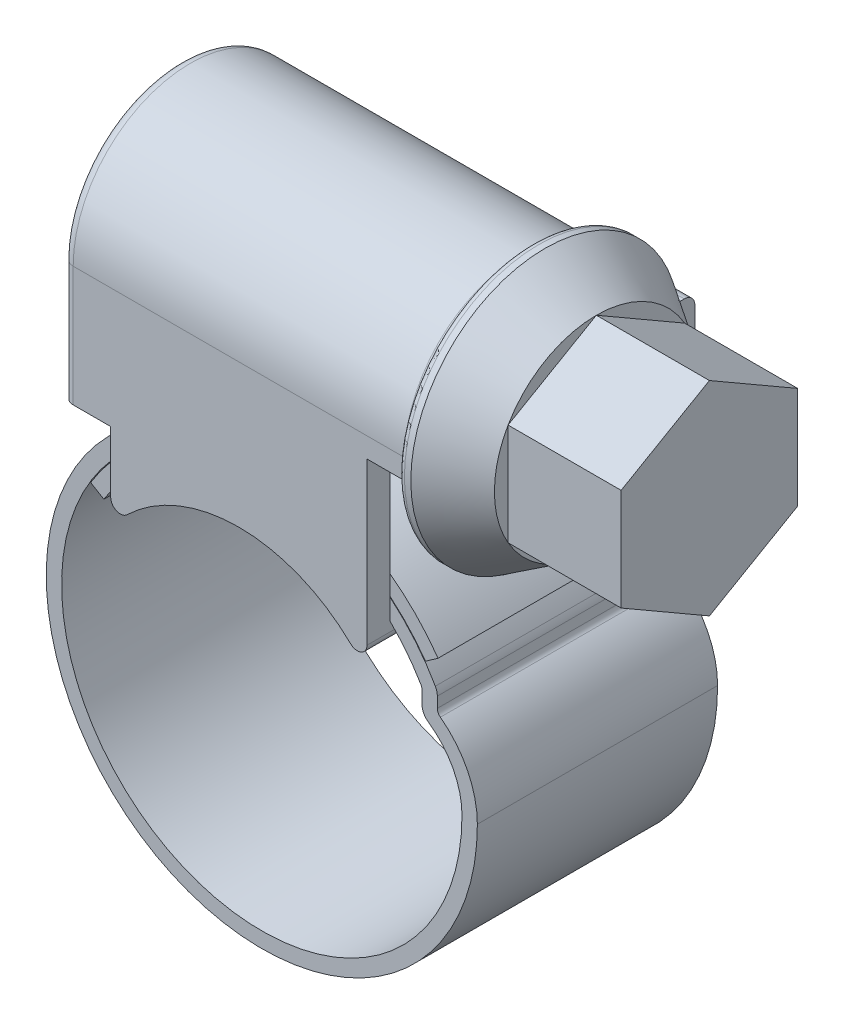
from build123d import *

# Parameters (mm, degrees)
EXTRUDE_THIN1_DEPTH      = 4.7625
BOSS_EXTRUDE1_DEPTH      = 6.98845
BOSS_EXTRUDE1_DEPTH_BACK = 6.98845
SHELL2_START             = -6.07845
SHELL2_DEPTH             = 12.1569
BOSS_EXTRUDE2_DEPTH      = 5.6725
BOSS_EXTRUDE2_DEPTH_BACK = 6.3921
BOSS_EXTRUDE9_START      = -0.91
BOSS_EXTRUDE9_DEPTH      = 0.91
BOSS_EXTRUDE10_START     = 0.91
BOSS_EXTRUDE10_DEPTH     = 0.91
CUT_EXTRUDE3_DEPTH       = 21.144492034
CUT_EXTRUDE3_DEPTH_BACK  = 21.144492034
FILLET3_R                = 0.419307
FILLET8_R                = 0.838614
CHAMFER2_SIZE            = 0.762
SKETCH31_W               = 0.91
SKETCH31_H               = 2.38125
BOSS_EXTRUDE7_DEPTH      = 7.0231
FILLET6_R                = 0.254
CUT_EXTRUDE4_DEPTH       = 24.499299408
CUT_EXTRUDE4_DEPTH_BACK  = 24.499299408
SKETCH35_W               = 1.90845
SKETCH35_H               = 3.96875
FILLET7_R                = 0.381
FILLET9_R                = 0.3048
FILLET10_R               = 0.6096


# Read off the part's stored shape, not the designer's step: Shell2
with BuildPart() as part:
    # Sketch2 → Extrude-Thin1 (new, symmetric)
    with BuildSketch(Plane.XY):
        with BuildLine():
            ThreePointArc((-6.262940862, 3.755273359), (0.086356754, 7.30198937), (6.35, 3.6061068))
            Line((6.35, 3.6061068), (6.35, 2.6917068))
            ThreePointArc((6.35, 2.6917068), (7.511063175, 1.56248534), (7.9375, 0))
            ThreePointArc((7.9375, 0), (-7.566981364, -2.396810231), (6.490016716, 4.569856592))
            Line((6.490016716, 4.569856592), (6.98845, 4.920821579))
            ThreePointArc((6.98845, 4.920821579), (-8.148125533, -2.580885257), (8.5471, 0))
            ThreePointArc((8.5471, 0), (8.126188249, 1.710330505), (6.9596, 3.029977804))
            Line((6.9596, 3.029977804), (6.9596, 3.763680944))
            ThreePointArc((6.9596, 3.763680944), (0.175564575, 7.910151926), (-6.785760274, 4.068757049))
            Line((-6.785760274, 4.068757049), (-6.262940862, 3.755273359))
        make_face()
    extrude(amount=EXTRUDE_THIN1_DEPTH, both=True)

    # Fillet9
    fillet9_edges = [part.edges().sort_by_distance(p)[0] for p in [
        (6.35, 3.6061068, 0),
        (6.9596, 3.029977804, 0),
    ]]
    fillet(fillet9_edges, radius=FILLET9_R)

    # Fillet10
    fillet10_edges = [part.edges().sort_by_distance(p)[0] for p in [
        (6.35, 2.6917068, 0),
        (6.9596, 3.763680944, 0),
    ]]
    fillet(fillet10_edges, radius=FILLET10_R)


with BuildPart() as body_2:
    # Sketch3 → Boss-Extrude1 (new, two sides: drawn at the far end of the back side and taken through both)
    with BuildSketch(Plane(origin=(0, 0, 0), x_dir=(0, 0, -1), z_dir=(1, 0, 0)).offset(-BOSS_EXTRUDE1_DEPTH_BACK)):
        with BuildLine():
            Line((-5.6725, 8.5471), (-5.6725, 7.29585))
            Line((-5.6725, 7.29585), (-4.7625, 7.29585))
            Line((-4.7625, 7.29585), (-4.7625, 8.5471))
            Line((-4.7625, 8.5471), (6.4175, 8.5471))
            Line((6.4175, 8.5471), (6.4175, 7.29585))
            Line((6.4175, 7.29585), (7.3275, 7.29585))
            Line((7.3275, 7.29585), (7.3275, 8.5471))
            Line((7.3275, 8.5471), (7.3275, 10.47085))
            Line((7.3275, 10.47085), (3.619930574, 10.47085))
            Line((3.619930574, 10.47085), (3.619930574, 12.058735616))
            ThreePointArc((3.619930574, 12.058735616), (-1.026284713, 16.704950903), (-5.6725, 12.058735616))
            Line((-5.6725, 12.058735616), (-5.6725, 10.47085))
            Line((-5.6725, 10.47085), (-5.6725, 8.5471))
        make_face()
    extrude(amount=BOSS_EXTRUDE1_DEPTH + BOSS_EXTRUDE1_DEPTH_BACK)

    # Shell2 outline → Shell2 (cut)
    with BuildSketch(Plane.YZ.offset(SHELL2_START)):
        with BuildLine():
            Line((8.5471, -6.4175), (9.56085, -6.4175))
            Line((9.56085, -6.4175), (9.56085, -2.709930574))
            Line((9.56085, -2.709930574), (12.058735616, -2.709930574))
            ThreePointArc((12.058735616, -2.709930574), (15.794950903, 1.026284713), (12.058735616, 4.7625))
            Line((12.058735616, 4.7625), (8.5471, 4.7625))
            Line((8.5471, 4.7625), (8.5471, -6.4175))
        make_face()
    extrude(amount=SHELL2_DEPTH, mode=Mode.SUBTRACT)


with BuildPart() as body_3:
    # Sketch4 → Boss-Extrude2 (new, two sides: drawn at the far end of the back side and taken through both)
    with BuildSketch(Plane.XY.offset(-BOSS_EXTRUDE2_DEPTH_BACK)):
        with BuildLine():
            Line((-5.08, 3.866297713), (-5.08, 5.245960946))
            ThreePointArc((-5.08, 5.245960946), (0, 7.3025), (5.08, 5.245960946))
            Line((5.08, 5.245960946), (5.08, 3.866297713))
            ThreePointArc((5.08, 3.866297713), (0, 6.3839375), (-5.08, 3.866297713))
        make_face()
    extrude(amount=BOSS_EXTRUDE2_DEPTH + BOSS_EXTRUDE2_DEPTH_BACK)


    add(body_2.part)  # Boss-Extrude9 merges body 2
    # Sketch6 → Boss-Extrude9 (add)
    with BuildSketch(Plane(origin=(0, 0, 4.7625), x_dir=(-1, 0, 0), z_dir=(0, 0, -1)).offset(BOSS_EXTRUDE9_START)):
        with BuildLine():
            Line((-5.08, 5.245960946), (-5.08, 9.56085))
            Line((-5.08, 9.56085), (5.08, 9.56085))
            Line((5.08, 9.56085), (5.08, 5.245960946))
            ThreePointArc((5.08, 5.245960946), (0, 7.3025), (-5.08, 5.245960946))
        make_face()
    extrude(amount=BOSS_EXTRUDE9_DEPTH)

    # Sketch7 → Boss-Extrude10 (add)
    with BuildSketch(Plane.XY.offset(-6.3921).offset(BOSS_EXTRUDE10_START)):
        with BuildLine():
            Line((5.08, 9.53545), (-5.08, 9.53545))
            Line((-5.08, 9.53545), (-5.08, 5.245960946))
            ThreePointArc((-5.08, 5.245960946), (0, 7.3025), (5.08, 5.245960946))
            Line((5.08, 5.245960946), (5.08, 9.53545))
        make_face()
    extrude(amount=-BOSS_EXTRUDE10_DEPTH)

    # Sketch25 → Cut-Extrude3 (cut, two sides: drawn at the far end of the back side and taken through both)
    with BuildSketch(Plane(origin=(0, 0, 0), x_dir=(0, 0, -1), z_dir=(1, 0, 0)).offset(-CUT_EXTRUDE3_DEPTH_BACK)):
        with BuildLine():
            Line((-3.407534713, 12.058735616), (-3.407534713, 8.5471))
            Line((-3.407534713, 8.5471), (1.354965287, 8.5471))
            Line((1.354965287, 8.5471), (1.354965287, 12.058735616))
            ThreePointArc((1.354965287, 12.058735616), (-1.026284713, 14.439985616), (-3.407534713, 12.058735616))
        make_face()
    extrude(amount=CUT_EXTRUDE3_DEPTH + CUT_EXTRUDE3_DEPTH_BACK, mode=Mode.SUBTRACT)

    # Fillet3
    fillet3_edges = [body_3.edges().sort_by_distance(p)[0] for p in [
        (-6.98845, 9.677292808, 5.6725),
        (-6.98845, 16.704950903, 1.026284713),
        (-6.98845, 11.264792808, -3.619930574),
        (0, 10.47085, -3.619930574),
        (-6.98845, 10.47085, -5.473715287),
        (0, 10.47085, -7.3275),
        (-6.98845, 8.88335, -7.3275),
        (6.98845, 9.677292808, 5.6725),
        (6.98845, 10.47085, -5.473715287),
        (6.98845, 11.264792808, -3.619930574),
        (6.98845, 16.704950903, 1.026284713),
    ]]
    fillet(fillet3_edges, radius=FILLET3_R)

    # Fillet8
    fillet8_edges = [body_3.edges().sort_by_distance(p)[0] for p in [
        (6.53345, 8.5471, -1.354965287),
        (-6.53345, 8.5471, -1.354965287),
        (6.53345, 8.5471, 3.407534713),
        (-6.53345, 8.5471, 3.407534713),
    ]]
    fillet(fillet8_edges, radius=FILLET8_R)

    # Sketch35 → Cut-Extrude4 (cut, two sides: drawn at the far end of the back side and taken through both)
    with BuildSketch(Plane.XY.offset(-CUT_EXTRUDE4_DEPTH_BACK)):
        with Locations((6.034225, 9.280225)):
            Rectangle(SKETCH35_W, SKETCH35_H)
    extrude(amount=CUT_EXTRUDE4_DEPTH + CUT_EXTRUDE4_DEPTH_BACK, mode=Mode.SUBTRACT)

    # Fillet7
    fillet7_edges = [body_3.edges().sort_by_distance(p)[0] for p in [
        (-5.08, 3.866297713, -0.3598),
        (5.08, 3.866297713, -0.3598),
    ]]
    fillet(fillet7_edges, radius=FILLET7_R)


with BuildPart() as body_3_2:
    # Sketch10 → Revolve1 (revolve)
    with BuildSketch(Plane.XY.offset(1.026284713), mode=Mode.PRIVATE) as revolve1_sk:
        Polygon((-6.07845, 9.677485616), (-6.07845, 12.058735616), (6.07845, 12.058735616), (6.07845, 9.677485616), (6.07845, 8.5471), (-6.07845, 8.5471), align=None)
    revolve(revolve1_sk.sketch.rotate(Axis((-6.07845, 12.058735616, 1.026284713), (1, 0, 0)), 270), axis=Axis((-6.07845, 12.058735616, 1.026284713), (1, 0, 0)))

    # Chamfer2
    chamfer2_edges = [body_3_2.edges().sort_by_distance(p)[0] for p in [
        (-6.07845, 12.058735616, -2.485350903),
        (6.07845, 12.058735616, -2.485350903),
    ]]
    chamfer(chamfer2_edges, length=CHAMFER2_SIZE)

    # Sketch31 → Revolve3 (revolve)
    with BuildSketch(Plane.XY.offset(1.026284713), mode=Mode.PRIVATE) as revolve3_sk:
        with Locations((-6.53345, 10.868110616)):
            Rectangle(SKETCH31_W, SKETCH31_H)
        with Locations((6.53345, 10.868110616)):
            Rectangle(SKETCH31_W, SKETCH31_H)
    revolve(revolve3_sk.sketch.rotate(Axis((6.98845, 12.058735616, 1.026284713), (-1, 0, 0)), 270), axis=Axis((6.98845, 12.058735616, 1.026284713), (-1, 0, 0)))

    # Sketch13 → Boss-Extrude7 (add)
    with BuildSketch(Plane(origin=(6.98845, 0, 0), x_dir=(0, 0, -1), z_dir=(1, 0, 0))):
        Polygon((-1.026284713, 16.1001875), (-4.526284713, 14.079461558), (-4.526284713, 10.038009674), (-1.026284713, 8.017283731), (2.473715287, 10.038009674), (2.473715287, 14.079461558), align=None)
    extrude(amount=BOSS_EXTRUDE7_DEPTH)

    # Sketch19 → Revolve2 (revolve)
    with BuildSketch(Plane.XY.offset(1.026284713), mode=Mode.PRIVATE) as revolve2_sk:
        Polygon((9.52845, 12.058735616), (9.52845, 16.1001875), (7.49645, 17.3839375), (6.98845, 17.3839375), (6.98845, 12.058735616), align=None)
    revolve(revolve2_sk.sketch.rotate(Axis((6.98845, 12.058735616, 1.026284713), (1, 0, 0)), 90), axis=Axis((6.98845, 12.058735616, 1.026284713), (1, 0, 0)))

    # Fillet6
    fillet6_edges = [body_3_2.edges().sort_by_distance(p)[0] for p in [
        (6.98845, 12.058735616, -4.298917171),
    ]]
    fillet(fillet6_edges, radius=FILLET6_R)


solid = Compound([part.part, body_3.part, body_3_2.part])
